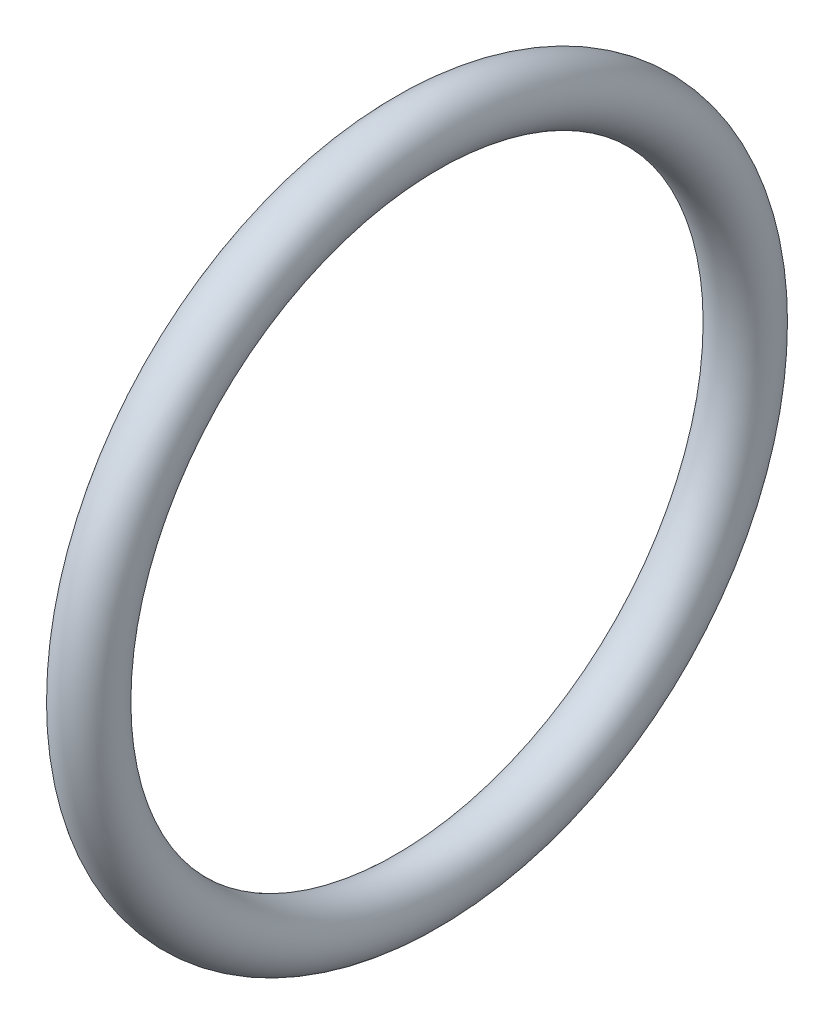
from build123d import *

# Parameters (mm, degrees)
SKETCH_1_R = 2.5


with BuildPart() as part:
    # 草图1 → 旋转1 (revolve)
    with BuildSketch(Plane.XY):
        with Locations((0, 27.5)):
            Circle(SKETCH_1_R)
    revolve(axis=Axis((-20.884003278, 0, 0), (1, 0, 0)))


solid = part.part
